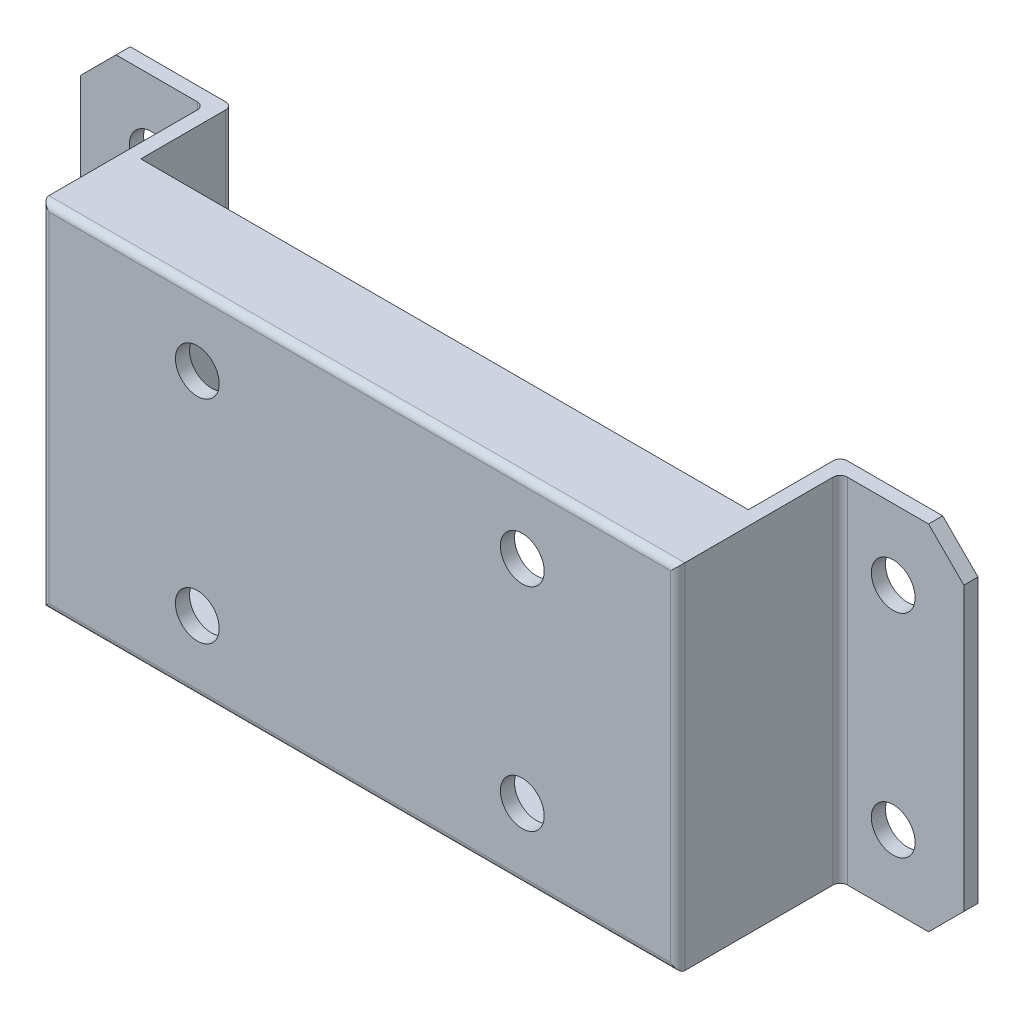
from build123d import *

# Parameters (mm, degrees)
SKETCH_1_W               = 90
SKETCH_1_H               = 50
SM_BASE_FLANGE_1_DEPTH   = 2
EXTRUDE_1_DEPTH          = 23
SKETCH_5_3_W             = 86
SKETCH_5_3_H             = 2
EXTRUDE_2_DEPTH          = 10
SKETCH_10_W              = 2
SKETCH_10_H              = 50
EXTRUDE_3_DEPTH          = 17.5
CUT_EXTRUDE_1_DEPTH      = 72.807033082
FILLET_1_R               = 1
SKETCH_12_R              = 3.1
CUT_EXTRUDE_2_DEPTH      = 72.807033082
SKETCH_13_R              = 3.1
CUT_EXTRUDE_3_DEPTH      = 72.807033082
MIRROR_5_COPY_1_SKETCH_R = 3.1
MIRROR_5_COPY_1_DEPTH    = 72.807033082
MIRROR_5_COPY_2_SKETCH_R = 3.1
MIRROR_5_COPY_2_DEPTH    = 72.807033082


# Sheet-metal steps are written as plain solids
with BuildPart() as part:
    # Sketch 1 → 基体-法兰1 (new body)
    with BuildSketch(Plane.XY):
        Rectangle(SKETCH_1_W, SKETCH_1_H)
    extrude(amount=-SM_BASE_FLANGE_1_DEPTH)

    # 草图5 → 凸台-拉伸1 (add)
    with BuildSketch(Plane(origin=(0, 0, -2), x_dir=(-1, 0, 0), z_dir=(0, 0, -1))):
        Polygon((-43, 25), (-45, 25), (-45, -25), (-43, -25), (-43, -23), (-43, 23), align=None)
        Polygon((45, 25), (43, 25), (43, 23), (43, -23), (43, -25), (45, -25), align=None)
    extrude(amount=EXTRUDE_1_DEPTH)

    # 草图5<3> → 凸台-拉伸2 (add)
    with BuildSketch(Plane(origin=(0, 0, -2), x_dir=(-1, 0, 0), z_dir=(0, 0, -1))):
        with Locations((0, 24)):
            Rectangle(SKETCH_5_3_W, SKETCH_5_3_H)
        with Locations((0, -24)):
            Rectangle(SKETCH_5_3_W, SKETCH_5_3_H)
    extrude(amount=EXTRUDE_2_DEPTH)

    # 草图10 → 凸台-拉伸3 (add)
    with BuildSketch(Plane.ZY.offset(45)):
        with Locations((-24, 0)):
            Rectangle(SKETCH_10_W, SKETCH_10_H)
    extrude_3 = extrude(amount=EXTRUDE_3_DEPTH)

    # 草图11 → 切除-拉伸1 (cut, through all)
    with BuildSketch(Plane(origin=(0, 0, -25), x_dir=(-1, 0, 0), z_dir=(0, 0, -1))):
        Polygon((57.5, 25), (62.5, 20), (62.5, 25), align=None)
        Polygon((57.5, -25), (62.5, -20), (62.5, -25), align=None)
    cut_extrude_1 = extrude(amount=-CUT_EXTRUDE_1_DEPTH, mode=Mode.SUBTRACT)

    # 镜向3: 凸台-拉伸3, 切除-拉伸1 across plane
    add(extrude_3.mirror(Plane(origin=(0, 0, 0), x_dir=(0, 0, 1), z_dir=(1, 0, 0))))
    add(cut_extrude_1.mirror(Plane(origin=(0, 0, 0), x_dir=(0, 0, 1), z_dir=(1, 0, 0))), mode=Mode.SUBTRACT)

    # 圆角1
    fillet_1_edges = [part.edges().sort_by_distance(p)[0] for p in [
        (-43, 0, -25),
        (-43, 0, -2),
        (43, 0, -2),
        (0, 23, -2),
        (0, -23, -2),
        (-45, 0, -23),
        (45, 0, -23),
        (0, 25, 0),
        (45, 0, 0),
        (0, -25, 0),
        (-45, 0, 0),
        (43, 0, -25),
    ]]
    fillet(fillet_1_edges, radius=FILLET_1_R)

    # 草图12 → 切除-拉伸2 (cut, through all)
    with BuildSketch(Plane(origin=(0, 0, -25), x_dir=(-1, 0, 0), z_dir=(0, 0, -1))):
        with Locations((-52.5, 15)):
            Circle(SKETCH_12_R)
    cut_extrude_2 = extrude(amount=-CUT_EXTRUDE_2_DEPTH, mode=Mode.SUBTRACT)

    # 草图13 → 切除-拉伸3 (cut, through all)
    with BuildSketch(Plane.XY):
        with Locations((23, 15)):
            Circle(SKETCH_13_R)
    cut_extrude_3 = extrude(amount=-CUT_EXTRUDE_3_DEPTH, mode=Mode.SUBTRACT)

    # 镜向4: 切除-拉伸2, 切除-拉伸3 across plane
    add(cut_extrude_2.mirror(Plane.ZX), mode=Mode.SUBTRACT)
    add(cut_extrude_3.mirror(Plane.ZX), mode=Mode.SUBTRACT)

    # 镜向5: 切除-拉伸2, 切除-拉伸3 across plane
    add(cut_extrude_2.mirror(Plane(origin=(0, 0, 0), x_dir=(0, 0, 1), z_dir=(1, 0, 0))), mode=Mode.SUBTRACT)
    add(cut_extrude_3.mirror(Plane(origin=(0, 0, 0), x_dir=(0, 0, 1), z_dir=(1, 0, 0))), mode=Mode.SUBTRACT)

    # 镜向5 copy 1 sketch → 镜向5 copy 1 (cut, through all)
    with BuildSketch(Plane(origin=(0, 0, -25), x_dir=(1, 0, 0), z_dir=(0, 0, -1))):
        with Locations((-52.5, 15)):
            Circle(MIRROR_5_COPY_1_SKETCH_R)
    extrude(amount=-MIRROR_5_COPY_1_DEPTH, mode=Mode.SUBTRACT)

    # 镜向5 copy 2 sketch → 镜向5 copy 2 (cut, through all)
    with BuildSketch(Plane(origin=(0, 0, 0), x_dir=(-1, 0, 0), z_dir=(0, 0, 1))):
        with Locations((23, 15)):
            Circle(MIRROR_5_COPY_2_SKETCH_R)
    extrude(amount=-MIRROR_5_COPY_2_DEPTH, mode=Mode.SUBTRACT)


solid = part.part
